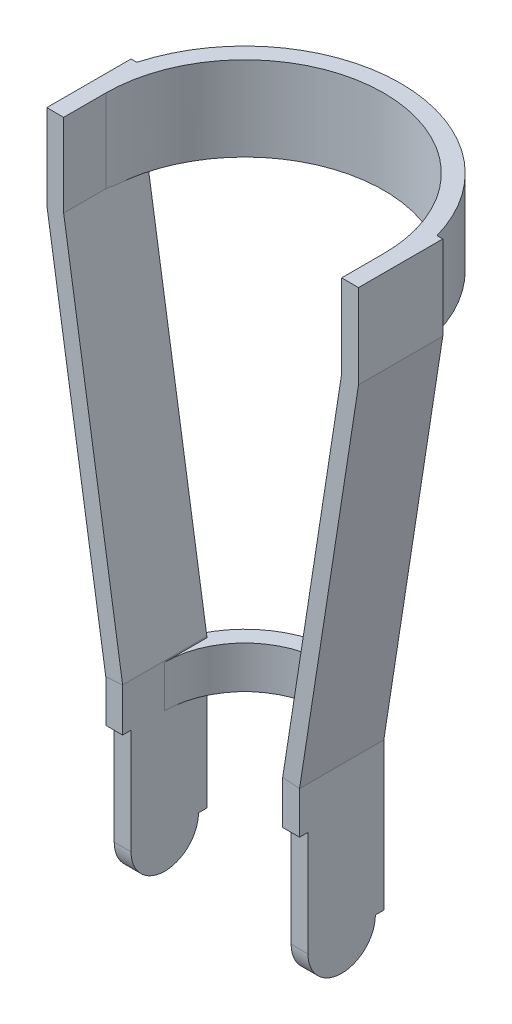
from build123d import *

# Parameters (mm, degrees)
EXTRUDE_4_DEPTH     = 20
EXTRUDE_START       = 50
EXTRUDE_8_DEPTH     = 20
SKETCH_16_W         = 8
SKETCH_16_H         = 40
SKETCH_19_W         = 8
SKETCH_19_H         = 40
SKETCH_21_R         = 16
EXTRUDE_13_DEPTH    = 8
EXTRUDE_START_2     = -8
SKETCH_22_R         = 16
EXTRUDE_14_DEPTH    = 8
SKETCH_23_W         = 7.590296008
SKETCH_23_H         = 50
CUT_EXTRUDE_2_DEPTH = 323.453097365


# Read off the part's stored shape, not the designer's step: 凸台-拉伸8
with BuildPart() as part:
    # Sketch 3D_1 → 凸台-拉伸4 (new, symmetric)
    with BuildSketch(Plane(origin=(-74, 270, 0), x_dir=(0.9909924304103234, 0, 0.13391789600139506), z_dir=(0, -1, 0))):
        with BuildLine():
            Line((0, 0), (2.67835792, 19.819848608))
            Line((2.67835792, 19.819848608), (10.606297363, 18.74850544))
            Line((10.606297363, 18.74850544), (7.927939443, -1.071343168))
            ThreePointArc((7.927939443, -1.071343168), (64.494858714, -75.315424711), (138.738940257, -18.74850544))
            Line((138.738940257, -18.74850544), (141.417298177, 1.071343168))
            Line((141.417298177, 1.071343168), (149.345237621, 0))
            Line((149.345237621, 0), (146.666879701, -19.819848608))
            ThreePointArc((146.666879701, -19.819848608), (63.423515546, -83.243364154), (0, 0))
        make_face()
    extrude(amount=EXTRUDE_4_DEPTH, both=True)



with BuildPart() as body_2:
    # 凸台-拉伸8 outline → 凸台-拉伸8 (new body)
    with BuildSketch(Plane(origin=(0, 0, 0), x_dir=(1, 0, 0), z_dir=(0, 1, 0)).offset(EXTRUDE_START)):
        with BuildLine():
            Line((38, 0), (38, -20))
            Line((38, -20), (46, -20))
            Line((46, -20), (46, 0))
            ThreePointArc((46, 0), (0, 46), (-46, 0))
            Line((-46, 0), (-46, -20))
            Line((-46, -20), (-38, -20))
            Line((-38, -20), (-38, 0))
            ThreePointArc((-38, 0), (0, 38), (38, 0))
        make_face()
    extrude(amount=EXTRUDE_8_DEPTH)


with BuildPart() as part_1:
    add(part.part)

    add(body_2.part)  # 扫描5 merges body 2
    # 扫描5: sweep along a path in 草图18
    with BuildLine(Plane.XY.offset(20)) as sweep_5_path:
        Line((-46, 0), (-46, 50))
        Line((-46, 50), (-46, 70))
        Line((-46, 70), (-74, 250))
        Line((-74, 250), (-74, 290))
    # 草图16 → 扫描5 (sweep)
    with BuildSketch(Plane(origin=(0, 0, 0), x_dir=(1, 0, 0), z_dir=(0, 1, 0))):
        with Locations((-42, 0)):
            Rectangle(SKETCH_16_W, SKETCH_16_H)
    sweep(path=sweep_5_path.line, transition=Transition.RIGHT)

    # 扫描6: sweep along a path in 草图20
    with BuildLine(Plane.XY.offset(20)) as sweep_6_path:
        Line((46, 0), (46, 50))
        Line((46, 50), (46, 70))
        Line((46, 70), (74, 250))
        Line((74, 250), (74, 290))
    # 草图19 → 扫描6 (sweep)
    with BuildSketch(Plane(origin=(0, 0, 0), x_dir=(1, 0, 0), z_dir=(0, 1, 0))):
        with Locations((42, 0)):
            Rectangle(SKETCH_19_W, SKETCH_19_H)
    sweep(path=sweep_6_path.line, transition=Transition.RIGHT)

    # 草图21 → 凸台-拉伸13 (add)
    with BuildSketch(Plane(origin=(46, 0, 0), x_dir=(0, 0, -1), z_dir=(1, 0, 0))):
        Circle(SKETCH_21_R)
    extrude(amount=-EXTRUDE_13_DEPTH)

    # 草图22 → 凸台-拉伸14 (add)
    with BuildSketch(Plane.ZY.offset(46).offset(EXTRUDE_START_2)):
        Circle(SKETCH_22_R)
    extrude(amount=EXTRUDE_14_DEPTH)

    # 草图23 → 切除-拉伸2 (cut, through all)
    with BuildSketch(Plane.ZY.offset(46)):
        with Locations((19.795148004, 25)):
            Rectangle(SKETCH_23_W, SKETCH_23_H)
    extrude(amount=-CUT_EXTRUDE_2_DEPTH, mode=Mode.SUBTRACT)


solid = part_1.part
